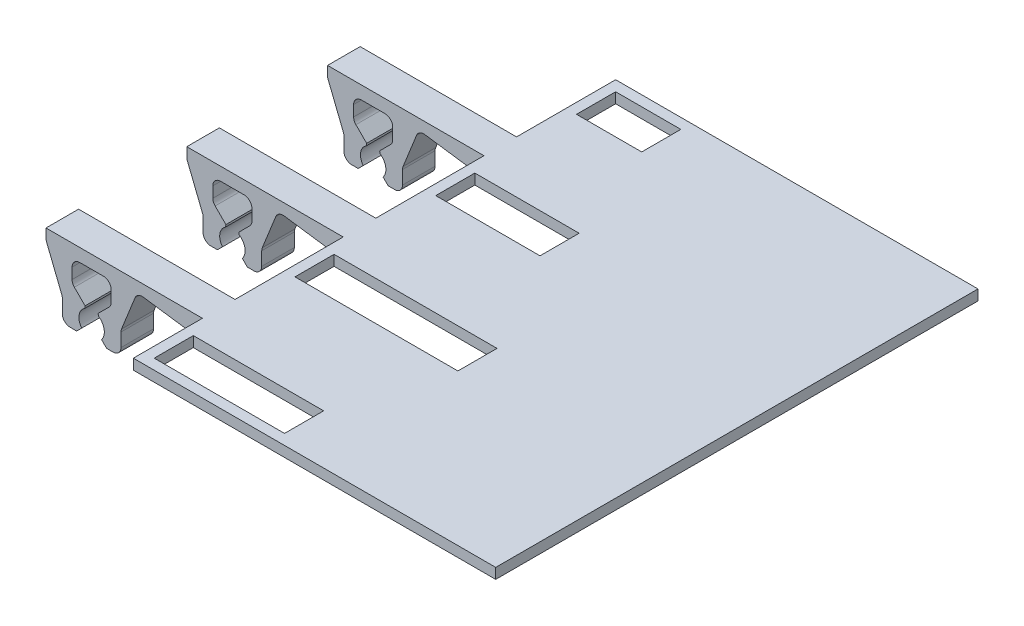
from build123d import *

# Parameters (mm, degrees)
SKETCH1_W                    = 55.6
SKETCH1_H                    = 74
PLATE_DEPTH                  = 1.6
SKETCH5_W                    = 10
SKETCH5_H                    = 6
SKETCH5_W_2                  = 16
SKETCH5_W_3                  = 25
SKETCH5_W_4                  = 20
AIR_WINDOW_DEPTH             = 1.6
CLIP_THIN_DEPTH              = 0.4
CLIPS_DEPTH                  = 5
CLIP_CUT1_DEPTH              = 10
SKETCH8_R                    = 1.95
CLIP_CUT2_DEPTH              = 76.3176101
FILLET1_R                    = 1.2
CHAMFER1_SIZE                = 0.8
CHAMFER1_SIZE_2              = 0.921400886
LPATTERN1_COUNT              = 3
LPATTERN1_PITCH              = 21.6
FILLET1_OF_LPATTERN1_R       = 1.2
CHAMFER1_OF_LPATTERN1_SIZE   = 0.8
CHAMFER1_OF_LPATTERN1_SIZE_2 = 0.921400886


with BuildPart() as part:
    # Sketch1 → plate (new body)
    with BuildSketch(Plane(origin=(0, 0, 0), x_dir=(1, 0, 0), z_dir=(0, 1, 0))):
        Rectangle(SKETCH1_W, SKETCH1_H)
    extrude(amount=PLATE_DEPTH)

    # Sketch5 → air window (cut)
    with BuildSketch(Plane(origin=(0, 1.6, 0), x_dir=(1, 0, 0), z_dir=(0, 1, 0))):
        with Locations((-21.2, 32.4)):
            Rectangle(SKETCH5_W, SKETCH5_H)
        with Locations((-18.2, 10.799998989)):
            Rectangle(SKETCH5_W_2, SKETCH5_H)
        with Locations((-13.7, -10.800001011)):
            Rectangle(SKETCH5_W_3, SKETCH5_H)
        with Locations((-16.2, -32.400001011)):
            Rectangle(SKETCH5_W_4, SKETCH5_H)
    extrude(amount=-AIR_WINDOW_DEPTH, mode=Mode.SUBTRACT)

    # Sketch11 → clip thin (cut)
    with BuildSketch(Plane.XZ):
        with BuildLine():
            Line((21.8, 34), (4.6, 34))
            ThreePointArc((4.6, 34), (2.478679656, 33.121320344), (1.6, 31))
            Line((1.6, 31), (1.6, -31))
            ThreePointArc((1.6, -31), (2.478679656, -33.121320344), (4.6, -34))
            Line((4.6, -34), (21.8, -34))
            ThreePointArc((21.8, -34), (23.921320344, -33.121320344), (24.8, -31))
            Line((24.8, -31), (24.8, 31))
            ThreePointArc((24.8, 31), (23.921320344, 33.121320344), (21.8, 34))
        make_face()
    extrude(amount=-CLIP_THIN_DEPTH, mode=Mode.SUBTRACT)

    # Sketch6 → clips (add)
    with BuildSketch(Plane.XY.offset(-16.799998989)):
        Polygon((-37.8, 0), (-40.3, -6.25), (-40.3, -9.75), (-49.3, -9.75), (-49.3, -6.25), (-51.8, 0), (-51.8, 1.6), (-37.8, 1.6), (-17.8, 1.6), (-17.8, 0), (-27.8, -1.4), align=None)
        Polygon((5.56, 1.6), (20.84, 1.6), (17.7, -6.25), (17.7, -9.75), (8.7, -9.75), (8.7, -6.25), align=None)
    clips = extrude(amount=-CLIPS_DEPTH)

    # Sketch7 → clip cut1 (cut)
    with BuildSketch(Plane.XY.offset(-16.799998989)):
        Polygon((-46.3, -9.75), (-43.3, -9.75), (-43.8, -5.75), (-41.8, -3.75), (-41.8, -0.4), (-47.8, -0.4), (-47.8, -3.75), (-45.8, -5.75), align=None)
        Polygon((12.2, -5.75), (11.7, -9.75), (14.7, -9.75), (14.2, -5.75), (16.2, -3.75), (16.2, 0.4), (10.2, 0.4), (10.2, -3.75), align=None)
    clip_cut1 = extrude(amount=-CLIP_CUT1_DEPTH, mode=Mode.SUBTRACT)

    # Sketch8 → clip cut2 (cut, through all)
    with BuildSketch(Plane.XY.offset(-16.799998989)):
        with Locations((-44.8, -7.75)):
            Circle(SKETCH8_R)
        with Locations((13.2, -8)):
            Circle(SKETCH8_R)
    clip_cut2 = extrude(amount=-CLIP_CUT2_DEPTH, mode=Mode.SUBTRACT)

    # Fillet1
    fillet1_edges = [part.edges().sort_by_distance(p)[0] for p in [
        (-37.8, 0, -19.299998989),
        (-40.3, -6.25, -19.299998989),
        (-40.3, -9.75, -19.299998989),
        (-49.3, -9.75, -19.299998989),
        (-49.3, -6.25, -19.299998989),
        (-51.8, 0, -19.299998989),
        (18.28, 0.4, -16.799998989),
        (20.36, 0.4, -19.299998989),
        (6.04, 0.4, -19.299998989),
        (18.28, 0.4, -21.799998989),
        (8.7, -6.25, -19.299998989),
        (17.7, -6.25, -19.299998989),
        (17.7, -9.75, -19.299998989),
        (8.7, -9.75, -19.299998989),
        (8.12, 0.4, -16.799998989),
        (8.12, 0.4, -21.799998989),
        (-47.8, -3.75, -19.299998989),
        (-47.8, -0.4, -19.299998989),
        (-41.8, -0.4, -19.299998989),
        (-41.8, -3.75, -19.299998989),
        (10.2, -3.75, -19.299998989),
        (10.2, 0.4, -19.299998989),
        (16.2, 0.4, -19.299998989),
        (16.2, -3.75, -19.299998989),
    ]]
    fillet(fillet1_edges, radius=FILLET1_R)

    # Chamfer1
    # the kernel refuses this chamfer: 0.921400886, 0.8 mm, written as the material it takes off along each edge
    with BuildSketch(Plane(origin=(-46.3, -9.75, -14.423092552), x_dir=(-0.9995027110658466, -0.03153300765899956, 0), z_dir=(0, 0, -1))) as chamfer1_piece_1:
        Polygon((CHAMFER1_SIZE * 0.999502711066, CHAMFER1_SIZE * 0.031533007659), (-CHAMFER1_SIZE_2 * 0.155262559294, CHAMFER1_SIZE_2 * 0.987873239155), (0, 0), align=None)
    extrude(amount=9.753812872, mode=Mode.SUBTRACT)
    with BuildSketch(Plane(origin=(-43.3, -9.75, -14.423092552), x_dir=(0.9995027110658466, -0.03153300765899956, 0), z_dir=(0, 0, -1))) as chamfer1_piece_2:
        Polygon((CHAMFER1_SIZE * 0.999502711066, -CHAMFER1_SIZE * 0.031533007659), (-CHAMFER1_SIZE_2 * 0.155262559294, -CHAMFER1_SIZE_2 * 0.987873239155), (0, 0), align=None)
    extrude(amount=9.753812872, mode=Mode.SUBTRACT)
    with BuildSketch(Plane(origin=(11.7, -9.75, -14.423092552), x_dir=(-0.9997167582174482, -0.023799229802586665, 0), z_dir=(0, 0, -1)), Plane(origin=(14.7, -9.75, -14.423092552), x_dir=(-0.14761505198581454, 0.9890448910070894, 0), z_dir=(0, 0, -1))) as chamfer1_piece_3:
        Polygon((CHAMFER1_SIZE_2 * 0.999716757696, CHAMFER1_SIZE_2 * 0.0237992297902), (-CHAMFER1_SIZE * 0.147615051986, CHAMFER1_SIZE * 0.989044891007), (0, 0), align=None)
    extrude(amount=9.753812872, mode=Mode.SUBTRACT)

    # LPattern1: clips, clip cut1, clip cut2 ×3
    with Locations(*[(0, 0, i * LPATTERN1_PITCH) for i in range(1, LPATTERN1_COUNT)]):
        add(clips)
        add(clip_cut1, mode=Mode.SUBTRACT)
        add(clip_cut2, mode=Mode.SUBTRACT)

    # Fillet1 of LPattern1
    fillet1_of_lpattern1_edges = [part.edges().sort_by_distance(p)[0] for p in [
        (-37.8, 0, 2.300001011),
        (-40.3, -6.25, 2.300001011),
        (-40.3, -9.75, 2.300001011),
        (-49.3, -9.75, 2.300001011),
        (-49.3, -6.25, 2.300001011),
        (-51.8, 0, 2.300001011),
        (18.28, 0.4, 4.800001011),
        (20.36, 0.4, 2.300001011),
        (6.04, 0.4, 2.300001011),
        (18.28, 0.4, -0.199998989),
        (8.7, -6.25, 2.300001011),
        (17.7, -6.25, 2.300001011),
        (17.7, -9.75, 2.300001011),
        (8.7, -9.75, 2.300001011),
        (8.12, 0.4, 4.800001011),
        (8.12, 0.4, -0.199998989),
        (-47.8, -3.75, 2.300001011),
        (-47.8, -0.4, 2.300001011),
        (-41.8, -0.4, 2.300001011),
        (-41.8, -3.75, 2.300001011),
        (10.2, -3.75, 2.300001011),
        (10.2, 0.4, 2.300001011),
        (16.2, 0.4, 2.300001011),
        (16.2, -3.75, 2.300001011),
        (-37.8, 0, 23.900001011),
        (-40.3, -6.25, 23.900001011),
        (-40.3, -9.75, 23.900001011),
        (-49.3, -9.75, 23.900001011),
        (-49.3, -6.25, 23.900001011),
        (-51.8, 0, 23.900001011),
        (18.28, 0.4, 26.400001011),
        (20.36, 0.4, 23.900001011),
        (6.04, 0.4, 23.900001011),
        (18.28, 0.4, 21.400001011),
        (8.7, -6.25, 23.900001011),
        (17.7, -6.25, 23.900001011),
        (17.7, -9.75, 23.900001011),
        (8.7, -9.75, 23.900001011),
        (8.12, 0.4, 26.400001011),
        (8.12, 0.4, 21.400001011),
        (-47.8, -3.75, 23.900001011),
        (-47.8, -0.4, 23.900001011),
        (-41.8, -0.4, 23.900001011),
        (-41.8, -3.75, 23.900001011),
        (10.2, -3.75, 23.900001011),
        (10.2, 0.4, 23.900001011),
        (16.2, 0.4, 23.900001011),
        (16.2, -3.75, 23.900001011),
    ]]
    fillet(fillet1_of_lpattern1_edges, radius=FILLET1_OF_LPATTERN1_R)

    # Chamfer1 of LPattern1
    # the kernel refuses this chamfer: 0.921400886, 0.8 mm, written as the material it takes off along each edge
    with BuildSketch(Plane(origin=(-46.3, -9.75, 7.176907448), x_dir=(-0.9995027110658466, -0.03153300765899956, 0), z_dir=(0, 0, -1)), Plane(origin=(-46.3, -9.75, 28.776907448), x_dir=(-0.9995027110658466, -0.03153300765899956, 0), z_dir=(0, 0, -1))) as chamfer1_of_lpattern1_piece_1:
        Polygon((CHAMFER1_OF_LPATTERN1_SIZE * 0.999502711066, CHAMFER1_OF_LPATTERN1_SIZE * 0.031533007659), (-CHAMFER1_OF_LPATTERN1_SIZE_2 * 0.155262559294, CHAMFER1_OF_LPATTERN1_SIZE_2 * 0.987873239155), (0, 0), align=None)
    extrude(amount=9.753812872, mode=Mode.SUBTRACT)
    with BuildSketch(Plane(origin=(-43.3, -9.75, 7.176907448), x_dir=(0.9995027110658466, -0.03153300765899956, 0), z_dir=(0, 0, -1)), Plane(origin=(-43.3, -9.75, 28.776907448), x_dir=(0.9995027110658466, -0.03153300765899956, 0), z_dir=(0, 0, -1))) as chamfer1_of_lpattern1_piece_2:
        Polygon((CHAMFER1_OF_LPATTERN1_SIZE * 0.999502711066, -CHAMFER1_OF_LPATTERN1_SIZE * 0.031533007659), (-CHAMFER1_OF_LPATTERN1_SIZE_2 * 0.155262559294, -CHAMFER1_OF_LPATTERN1_SIZE_2 * 0.987873239155), (0, 0), align=None)
    extrude(amount=9.753812872, mode=Mode.SUBTRACT)
    with BuildSketch(Plane(origin=(11.7, -9.75, 7.176907448), x_dir=(-0.9997167582174482, -0.023799229802586665, 0), z_dir=(0, 0, -1)), Plane(origin=(14.7, -9.75, 7.176907448), x_dir=(-0.14761505198581454, 0.9890448910070894, 0), z_dir=(0, 0, -1)), Plane(origin=(11.7, -9.75, 28.776907448), x_dir=(-0.9997167582174482, -0.023799229802586665, 0), z_dir=(0, 0, -1)), Plane(origin=(14.7, -9.75, 28.776907448), x_dir=(-0.14761505198581454, 0.9890448910070894, 0), z_dir=(0, 0, -1))) as chamfer1_of_lpattern1_piece_3:
        Polygon((CHAMFER1_OF_LPATTERN1_SIZE_2 * 0.999716757696, CHAMFER1_OF_LPATTERN1_SIZE_2 * 0.0237992297902), (-CHAMFER1_OF_LPATTERN1_SIZE * 0.147615051986, CHAMFER1_OF_LPATTERN1_SIZE * 0.989044891007), (0, 0), align=None)
    extrude(amount=9.753812872, mode=Mode.SUBTRACT)


solid = part.part
